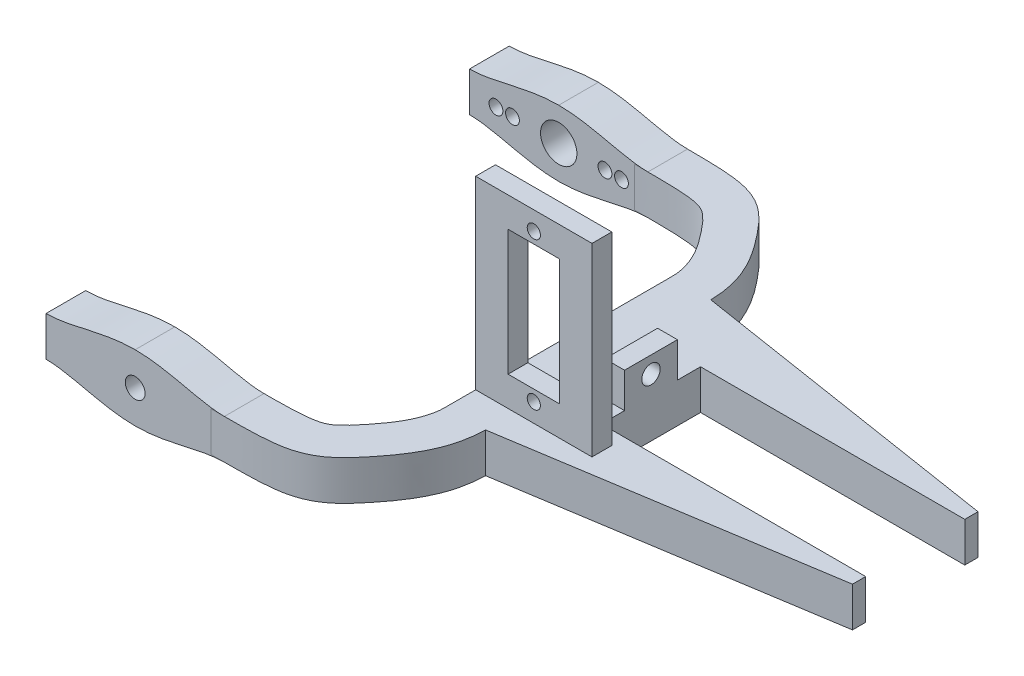
from build123d import *

# Parameters (mm, degrees)
SKETCH1_W             = 11
SKETCH1_H             = 5.75
BOSS_EXTRUDE1_DEPTH   = 6
BOSS_EXTRUDE1_2_DEPTH = 6
SKETCH2_W             = 14
SKETCH2_H             = 34.11
BOSS_EXTRUDE2_DEPTH   = 6
SWEEP1_DEPTH          = 6
CUT_EXTRUDE3_REACH    = 83.397
SKETCH14_R            = 2.75
SKETCH14_R_2          = 1.05
BOSS_EXTRUDE9_DEPTH   = 6
CUT_EXTRUDE4_REACH    = 91.712
SKETCH18_R            = 1.5
SKETCH22_W            = 19
SKETCH22_H            = 5.75
CUT_EXTRUDE5_DEPTH    = 6
BOSS_EXTRUDE10_DEPTH  = 6
SKETCH24_W            = 8
SKETCH24_H            = 5.3
SKETCH24_R            = 1.4
BOSS_EXTRUDE11_DEPTH  = 3
SKETCH25_W            = 17.61
SKETCH25_H            = 34
SKETCH25_R            = 1
SKETCH25_W_2          = 7.8
SKETCH25_H_2          = 19
BOSS_EXTRUDE12_DEPTH  = 3


# Read off the part's stored shape, not the designer's step: Sweep1
with BuildPart() as part:
    # Sketch1 → Boss-Extrude1 (new body)
    with BuildSketch(Plane(origin=(0, 0, 0), x_dir=(1, 0, 0), z_dir=(0, 1, 0))):
        with Locations((-0.22, -0.335)):
            Rectangle(SKETCH1_W, SKETCH1_H)
    extrude(amount=BOSS_EXTRUDE1_DEPTH)



with BuildPart() as body_2:
    # Sketch1 → Boss-Extrude1 2 (new body)
    with BuildSketch(Plane(origin=(0, 0, 0), x_dir=(1, 0, 0), z_dir=(0, 1, 0))):
        with Locations((-0.22, 28.025)):
            Rectangle(SKETCH1_W, SKETCH1_H)
    extrude(amount=BOSS_EXTRUDE1_2_DEPTH)


with BuildPart() as part_1:
    add(part.part)

    add(body_2.part)  # Boss-Extrude2 merges body 2
    # Sketch2 → Boss-Extrude2 (add)
    with BuildSketch(Plane(origin=(0, 6, 0), x_dir=(1, 0, 0), z_dir=(0, 1, 0))):
        with Locations((-12.72, 13.845)):
            Rectangle(SKETCH2_W, SKETCH2_H)
    extrude(amount=-BOSS_EXTRUDE2_DEPTH)

    # Sweep1 outline → Sweep1 (add)
    with BuildSketch(Plane(origin=(0, 0, 0), x_dir=(1, 0, 0), z_dir=(0, 1, 0))):
        with BuildLine():
            Line((-19.72, 30.9), (-13.72, 30.9))
            add(Edge.make_bspline(
                [(-13.72, 30.9), (-13.743378697, 32.253211022), (-14.090289559, 34.833964919), (-15.409423187, 38.079059102), (-17.043715685, 40.73683074), (-18.099148165, 42.105836305), (-19.090886132, 43.357706905), (-20.011305167, 44.479459776), (-21.468793566, 45.971145386), (-23.363216319, 47.361256345), (-25.837404204, 48.336252829), (-28.791002032, 48.76455303), (-32.3556727, 48.8986286), (-35.441246941, 48.900115732), (-37.241969243, 48.9)],
                knots=[0, 0, 0, 0, 0.0784, 0.1568, 0.2352, 0.3136, 0.313701739, 0.395733333, 0.477866667, 0.56, 0.67, 0.78, 0.89, 1, 1, 1, 1], degree=3))
            Line((-37.241969243, 48.9), (-62.241969243, 48.9))
            Line((-62.241969243, 48.9), (-62.241969243, 42.9))
            Line((-62.241969243, 42.9), (-37.241969243, 42.9))
            add(Edge.make_bspline(
                [(-19.72, 30.9), (-19.696621303, 31.714094845), (-19.950017379, 33.216616387), (-20.771838362, 35.336087782), (-21.958568069, 37.276195445), (-22.864849742, 38.458747258), (-23.729609046, 39.551173044), (-24.547340674, 40.543113387), (-25.475844259, 41.467623937), (-26.28746543, 42.042193199), (-27.236900522, 42.442031057), (-29.211686377, 42.772284261), (-32.399799893, 42.897934209), (-35.455956005, 42.899884268), (-37.241969243, 42.9)],
                knots=[0, 0, 0, 0, 0.0784, 0.1568, 0.2352, 0.3136, 0.313701739, 0.395733333, 0.477866667, 0.56, 0.67, 0.78, 0.89, 1, 1, 1, 1], degree=3))
        make_face()
    sweep1 = extrude(amount=SWEEP1_DEPTH)

    # Sketch14 → Cut-Extrude3 (cut, up to next)
    with BuildSketch(Plane(origin=(0, 0, -48.9), x_dir=(-1, 0, 0), z_dir=(0, 0, -1)), mode=Mode.PRIVATE) as cut_extrude3_sk1:
        with Locations(Location((48.741969243, 3, 0), (0, 0, 90))):
            Circle(SKETCH14_R)
    cut_extrude3_tool1 = extrude(cut_extrude3_sk1.sketch, amount=-CUT_EXTRUDE3_REACH, mode=Mode.PRIVATE) & part_1.part
    # Sketch14 → Cut-Extrude3 (cut, up to next)
    with BuildSketch(Plane(origin=(0, 0, -48.9), x_dir=(-1, 0, 0), z_dir=(0, 0, -1)), mode=Mode.PRIVATE) as cut_extrude3_sk2:
        with Locations(Location((55.741969243, 3, 0), (0, 0, 90))):
            Circle(SKETCH14_R_2)
    cut_extrude3_tool2 = extrude(cut_extrude3_sk2.sketch, amount=-CUT_EXTRUDE3_REACH, mode=Mode.PRIVATE) & part_1.part
    # Sketch14 → Cut-Extrude3 (cut, up to next)
    with BuildSketch(Plane(origin=(0, 0, -48.9), x_dir=(-1, 0, 0), z_dir=(0, 0, -1)), mode=Mode.PRIVATE) as cut_extrude3_sk3:
        with Locations(Location((58.241969243, 3, 0), (0, 0, 90))):
            Circle(SKETCH14_R_2)
    cut_extrude3_tool3 = extrude(cut_extrude3_sk3.sketch, amount=-CUT_EXTRUDE3_REACH, mode=Mode.PRIVATE) & part_1.part
    # Sketch14 → Cut-Extrude3 (cut, up to next)
    with BuildSketch(Plane(origin=(0, 0, -48.9), x_dir=(-1, 0, 0), z_dir=(0, 0, -1)), mode=Mode.PRIVATE) as cut_extrude3_sk4:
        with Locations(Location((39.241969243, 3, 0), (0, 0, 180))):
            Circle(SKETCH14_R_2)
    cut_extrude3_tool4 = extrude(cut_extrude3_sk4.sketch, amount=-CUT_EXTRUDE3_REACH, mode=Mode.PRIVATE) & part_1.part
    # Sketch14 → Cut-Extrude3 (cut, up to next)
    with BuildSketch(Plane(origin=(0, 0, -48.9), x_dir=(-1, 0, 0), z_dir=(0, 0, -1)), mode=Mode.PRIVATE) as cut_extrude3_sk5:
        with Locations(Location((41.741969243, 3, 0), (0, 0, 180))):
            Circle(SKETCH14_R_2)
    cut_extrude3_tool5 = extrude(cut_extrude3_sk5.sketch, amount=-CUT_EXTRUDE3_REACH, mode=Mode.PRIVATE) & part_1.part
    add(cut_extrude3_tool1.solids().sort_by_distance((-48.741969, 3, -48.9))[0], mode=Mode.SUBTRACT)
    add(cut_extrude3_tool2.solids().sort_by_distance((-55.741969, 3, -48.9))[0], mode=Mode.SUBTRACT)
    add(cut_extrude3_tool3.solids().sort_by_distance((-58.241969, 3, -48.9))[0], mode=Mode.SUBTRACT)
    add(cut_extrude3_tool4.solids().sort_by_distance((-39.241969, 3, -48.9))[0], mode=Mode.SUBTRACT)
    add(cut_extrude3_tool5.solids().sort_by_distance((-41.741969, 3, -48.9))[0], mode=Mode.SUBTRACT)

    # Sketch15 → Boss-Extrude9 (add)
    with BuildSketch(Plane(origin=(0, 0, -48.9), x_dir=(-1, 0, 0), z_dir=(0, 0, -1))):
        with BuildLine():
            Line((35.241969243, 6), (62.241969243, 6))
            add(Edge.make_bspline(
                [(62.241969243, 6), (59.264471213, 6), (54.912549695, 7.524480449), (49.955213663, 8), (48.741969243, 8)],
                knots=[0, 0, 0, 0, 0.762240224, 1, 1, 1, 1], degree=3))
            add(Edge.make_bspline(
                [(35.241969243, 6), (38.219467274, 6), (42.571388792, 7.524480449), (47.528724824, 8), (48.741969243, 8)],
                knots=[0, 0, 0, 0, 0.762240224, 1, 1, 1, 1], degree=3))
        make_face()
        with BuildLine():
            Line((35.241969243, 0), (62.241969243, 0))
            add(Edge.make_bspline(
                [(62.241969243, 0), (59.264471213, 0), (54.912549695, -1.524480449), (49.955213663, -2), (48.741969243, -2)],
                knots=[0, 0, 0, 0, 0.762240224, 1, 1, 1, 1], degree=3))
            add(Edge.make_bspline(
                [(35.241969243, 0), (38.219467274, 0), (42.571388792, -1.524480449), (47.528724824, -2), (48.741969243, -2)],
                knots=[0, 0, 0, 0, 0.762240224, 1, 1, 1, 1], degree=3))
        make_face()
    boss_extrude9 = extrude(amount=-BOSS_EXTRUDE9_DEPTH)

    # Mirror1: Sweep1, Boss-Extrude9 across plane
    add(sweep1.mirror(Plane(origin=(0, 0, -13.845), x_dir=(1, 0, 0), z_dir=(0, 0, -1))))
    add(boss_extrude9.mirror(Plane(origin=(0, 0, -13.845), x_dir=(1, 0, 0), z_dir=(0, 0, -1))))

    # Sketch18 → Cut-Extrude4 (cut, up to next)
    with BuildSketch(Plane(origin=(0, 0, 15.21), x_dir=(-1, 0, 0), z_dir=(0, 0, -1)), mode=Mode.PRIVATE) as cut_extrude4_sk1:
        with Locations(Location((48.741969243, 3, 0), (0, 0, 90))):
            Circle(SKETCH18_R)
    cut_extrude4_tool1 = extrude(cut_extrude4_sk1.sketch, amount=-CUT_EXTRUDE4_REACH, mode=Mode.PRIVATE) & part_1.part
    add(cut_extrude4_tool1.solids().sort_by_distance((-48.741969, 3, 15.21))[0], mode=Mode.SUBTRACT)

    # Sketch22 → Cut-Extrude5 (cut)
    with BuildSketch(Plane(origin=(0, 6, 0), x_dir=(1, 0, 0), z_dir=(0, 1, 0))):
        with Locations((-4.22, -0.335)):
            Rectangle(SKETCH22_W, SKETCH22_H)
    cut_extrude5 = extrude(amount=-CUT_EXTRUDE5_DEPTH, mode=Mode.SUBTRACT)

    # Mirror2: Cut-Extrude5 across plane
    add(cut_extrude5.mirror(Plane(origin=(0, 0, -13.845), x_dir=(1, 0, 0), z_dir=(0, 0, -1))), mode=Mode.SUBTRACT)

    # Sketch23 → Boss-Extrude10 (add)
    with BuildSketch(Plane(origin=(0, 6, 0), x_dir=(1, 0, 0), z_dir=(0, 1, 0))):
        Polygon((-5.72, 6.345), (34.28, 6.345), (34.28, 4.345), (-13.72, -3.21), (-13.72, 2.54), (-5.72, 2.54), align=None)
    boss_extrude10 = extrude(amount=-BOSS_EXTRUDE10_DEPTH)

    # Mirror3: Boss-Extrude10 across plane
    add(boss_extrude10.mirror(Plane(origin=(0, 0, -13.845), x_dir=(1, 0, 0), z_dir=(0, 0, -1))))

    # Sketch24 → Boss-Extrude11 (add)
    with BuildSketch(Plane(origin=(-5.72, 0, 0), x_dir=(0, 0, -1), z_dir=(1, 0, 0))):
        with Locations((13.845, 8.65)):
            Rectangle(SKETCH24_W, SKETCH24_H)
        with Locations((13.845, 8.77)):
            Circle(SKETCH24_R, mode=Mode.SUBTRACT)
    extrude(amount=-BOSS_EXTRUDE11_DEPTH)

    # Sketch25 → Boss-Extrude12 (add)
    with BuildSketch(Plane(origin=(0, 0, -1.305), x_dir=(-1, 0, 0), z_dir=(0, 0, -1))):
        with Locations((10.915, 17)):
            Rectangle(SKETCH25_W, SKETCH25_H)
        with Locations((10.915, 31.175)):
            Circle(SKETCH25_R, mode=Mode.SUBTRACT)
        with Locations((10.915, 8.825)):
            Circle(SKETCH25_R, mode=Mode.SUBTRACT)
        with Locations((10.915, 20)):
            Rectangle(SKETCH25_W_2, SKETCH25_H_2, mode=Mode.SUBTRACT)
    extrude(amount=BOSS_EXTRUDE12_DEPTH)


solid = part_1.part
